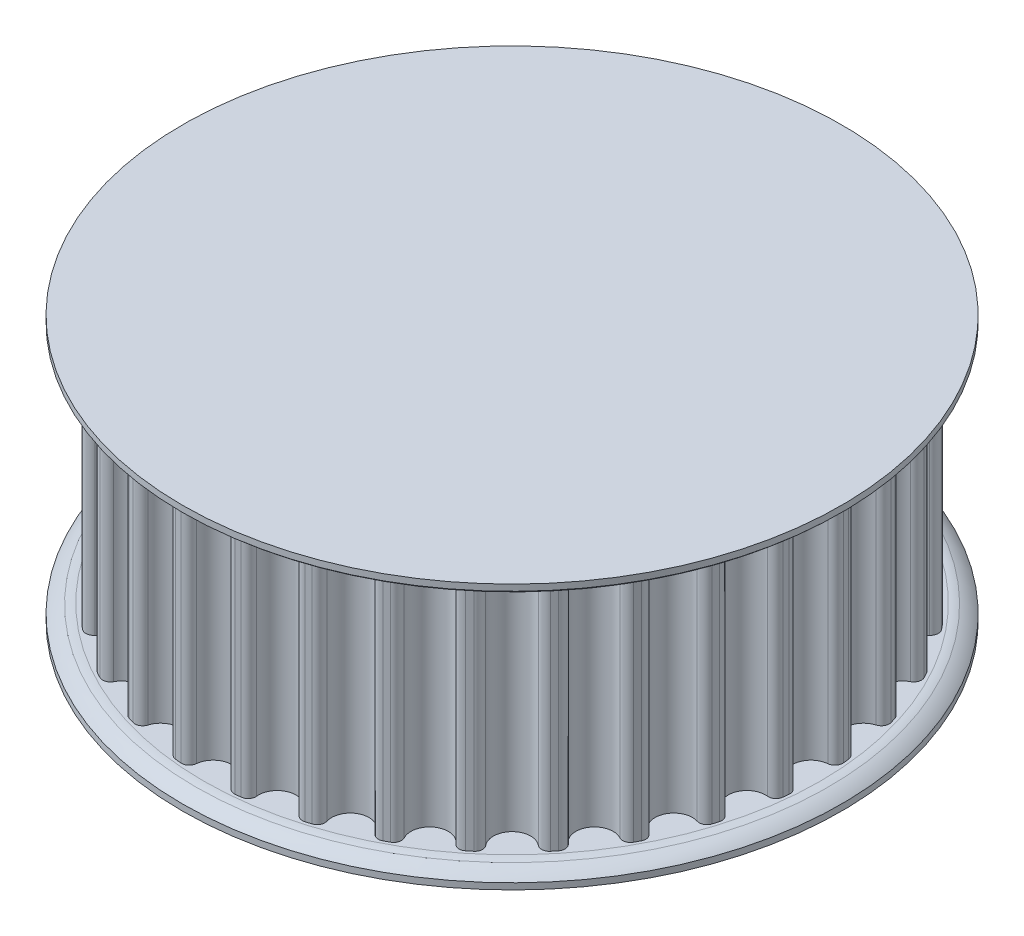
from build123d import *

# Parameters (mm, degrees)
SKETCH1_R          = 24.893290416
TOOTHOD_DEPTH      = 9.525
TOOTHPROFILE_DEPTH = 41.028169025
TOOTHPATTERN_COUNT = 32


with BuildPart() as part:
    # Sketch1 → ToothOD (new, symmetric)
    with BuildSketch(Plane(origin=(0, 0, 0), x_dir=(1, 0, 0), z_dir=(0, 1, 0))):
        Circle(SKETCH1_R)
    extrude(amount=TOOTHOD_DEPTH, both=True)

    # Sketch2 → ToothProfile (cut, through all)
    with BuildSketch(Plane(origin=(0, 9.525, 0), x_dir=(1, 0, 0), z_dir=(0, 1, 0))):
        with BuildLine():
            ThreePointArc((-1.51873664, 24.220217905), (0, 22.833290416), (1.51873664, 24.220217905))
            ThreePointArc((1.51873664, 24.220217905), (1.744157145, 24.650166921), (2.20743789, 24.795223848))
            ThreePointArc((2.20743789, 24.795223848), (0, 24.893290416), (-2.20743789, 24.795223848))
            ThreePointArc((-2.20743789, 24.795223848), (-1.744157145, 24.650166921), (-1.51873664, 24.220217905))
        make_face()
    toothprofile = extrude(amount=-TOOTHPROFILE_DEPTH, mode=Mode.SUBTRACT)

    # ToothPattern: ToothProfile ×32 about axis
    toothpattern_axis = Axis((0, 9.525, 0), (0, -1, 0))
    for i in range(1, TOOTHPATTERN_COUNT):
        add(toothprofile.rotate(toothpattern_axis, i * 360 / TOOTHPATTERN_COUNT), mode=Mode.SUBTRACT)

    # Sketch4 → Flange (revolve)
    with BuildSketch(Plane.XY):
        with BuildLine():
            Line((0, -9.525), (25.147290416, -9.525))
            ThreePointArc((25.147290416, -9.525), (25.473046406, -9.550622571), (25.792862744, -9.617637424))
            ThreePointArc((25.792862744, -9.617637424), (26.360591321, -9.899197125), (26.861790416, -10.287))
            Line((26.861790416, -10.287), (26.861790416, -10.795))
            Line((26.861790416, -10.795), (0, -10.795))
            Line((0, -10.795), (0, -9.525))
        make_face()
        with BuildLine():
            Line((26.861790416, 10.795), (26.861790416, 10.287))
            ThreePointArc((26.861790416, 10.287), (26.360591321, 9.899197125), (25.792862744, 9.617637424))
            ThreePointArc((25.792862744, 9.617637424), (25.473046406, 9.550622571), (25.147290416, 9.525))
            Line((25.147290416, 9.525), (0, 9.525))
            Line((0, 9.525), (0, 10.795))
            Line((0, 10.795), (26.861790416, 10.795))
        make_face()
    revolve(axis=Axis((0, 12.09802, 0), (0, -1, 0)))


solid = part.part
